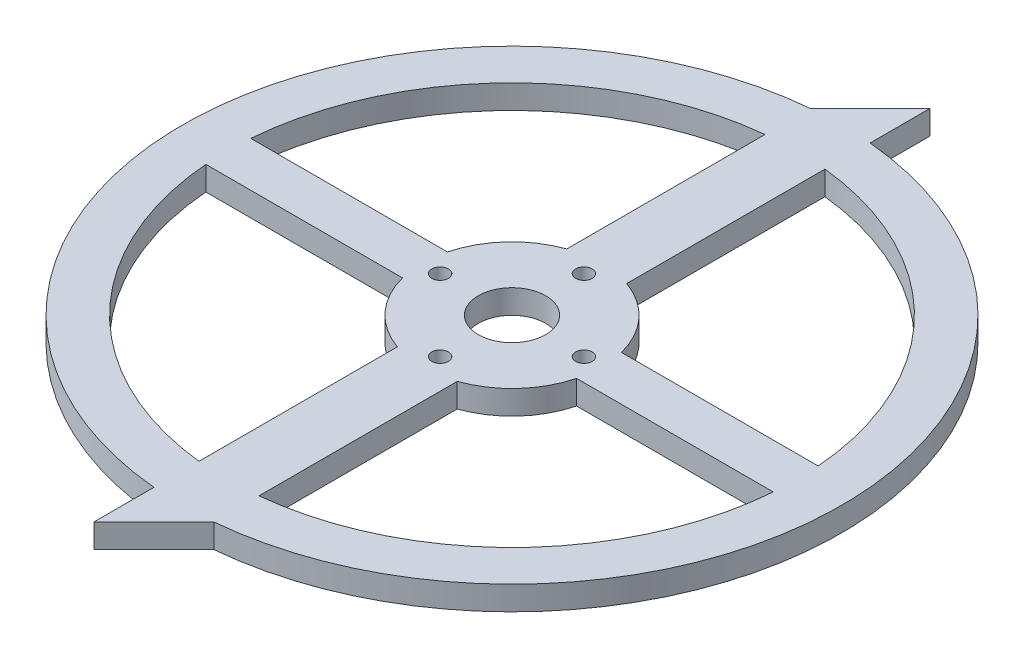
from build123d import *

# Parameters (mm, degrees)
BOSS_EXTRUDE1_DEPTH = 5.08
SKETCH2_R           = 7.14375
SKETCH2_R_2         = 1.7526
CUT_EXTRUDE1_DEPTH  = 6.35


with BuildPart() as part:
    # Sketch1 → Boss-Extrude1 (new body)
    with BuildSketch(Plane(origin=(0, 0, 0), x_dir=(1, 0, 0), z_dir=(0, 1, 0))):
        with BuildLine():
            ThreePointArc((-6.35, 69.560764803), (-69.85, 0), (-6.35, -69.560764803))
            Line((-6.35, -69.560764803), (-6.35, -82.260764803))
            Line((-6.35, -82.260764803), (6.35, -69.560764803))
            ThreePointArc((6.35, -69.560764803), (69.85, 0), (6.35, 69.560764803))
            Line((6.35, 69.560764803), (6.35, 82.260764803))
            Line((6.35, 82.260764803), (-6.35, 69.560764803))
        make_face()
        with BuildLine():
            Line((-6.35, 59.989858518), (-6.35, 17.960512242))
            ThreePointArc((-6.35, 17.960512242), (-14.044426629, 12.870764572), (-18.445083186, 4.7625))
            Line((-18.445083186, 4.7625), (-60.136712736, 4.7625))
            ThreePointArc((-60.136712736, 4.7625), (-43.216154674, 42.088829874), (-6.35, 59.989858518))
        make_face(mode=Mode.SUBTRACT)
        with BuildLine():
            Line((6.35, 17.960512242), (6.35, 59.989858518))
            ThreePointArc((6.35, 59.989858518), (43.216154674, 42.088829874), (60.136712736, 4.7625))
            Line((60.136712736, 4.7625), (18.445083186, 4.7625))
            ThreePointArc((18.445083186, 4.7625), (14.044426629, 12.870764572), (6.35, 17.960512242))
        make_face(mode=Mode.SUBTRACT)
        with BuildLine():
            ThreePointArc((-6.35, -59.989858518), (-43.216154674, -42.088829874), (-60.136712736, -4.7625))
            Line((-60.136712736, -4.7625), (-18.445083186, -4.7625))
            ThreePointArc((-18.445083186, -4.7625), (-14.044426629, -12.870764572), (-6.35, -17.960512242))
            Line((-6.35, -17.960512242), (-6.35, -59.989858518))
        make_face(mode=Mode.SUBTRACT)
        with BuildLine():
            ThreePointArc((60.136712736, -4.7625), (43.216154674, -42.088829874), (6.35, -59.989858518))
            Line((6.35, -59.989858518), (6.35, -17.960512242))
            ThreePointArc((6.35, -17.960512242), (14.044426629, -12.870764572), (18.445083186, -4.7625))
            Line((18.445083186, -4.7625), (60.136712736, -4.7625))
        make_face(mode=Mode.SUBTRACT)
    extrude(amount=BOSS_EXTRUDE1_DEPTH)

    # Sketch2 → Cut-Extrude1 (cut)
    with BuildSketch(Plane(origin=(0, 5.08, 0), x_dir=(1, 0, 0), z_dir=(0, 1, 0))):
        Circle(SKETCH2_R)
        with Locations((-15.24, 0)):
            Circle(SKETCH2_R_2)
        with Locations((0, 15.24)):
            Circle(SKETCH2_R_2)
        with Locations((15.24, 0)):
            Circle(SKETCH2_R_2)
        with Locations((0, -15.24)):
            Circle(SKETCH2_R_2)
    extrude(amount=-CUT_EXTRUDE1_DEPTH, mode=Mode.SUBTRACT)


solid = part.part
